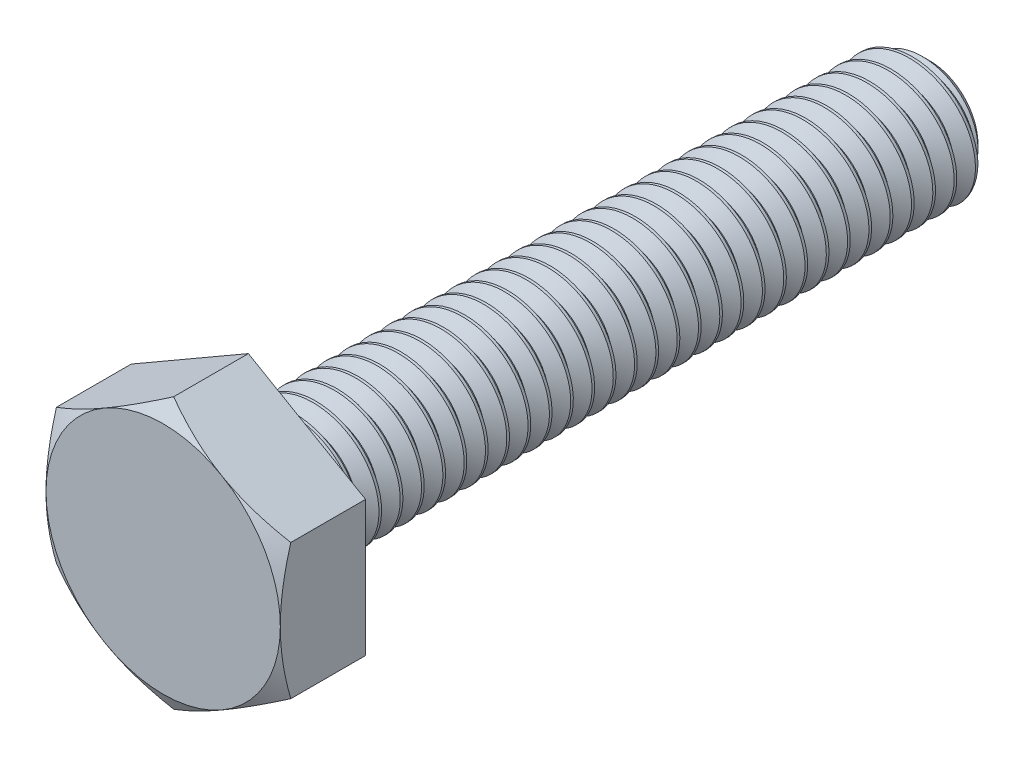
from build123d import *

# Parameters (mm, degrees)
BOSS_EXTRUDE1_DEPTH = 2
SKETCH4_OUTSIDE_W   = 78.966
SKETCH4_OUTSIDE_H   = 79.816
SKETCH4_OUTSIDE_R   = 2.75
CUT_EXTRUDE1_DEPTH  = 19.483663959
CUT_EXTRUDE1_DRAFT  = -60
CUT_SWEEP1_PITCH    = 0.5
CUT_SWEEP1_TO       = 16


with BuildPart() as part:
    # Sketch2 → Revolve1 (revolve)
    with BuildSketch(Plane(origin=(0, 0, 0), x_dir=(0, 0, -1), z_dir=(1, 0, 0)), mode=Mode.PRIVATE) as revolve1_sk:
        Polygon((-9, 2.75), (-9, 0), (9, 0), (9, 1.125), (8.625, 1.5), (-7, 1.5), (-7, 2.75), align=None)
    revolve(revolve1_sk.sketch.rotate(Axis((0, 0, 9), (0, 0, -1)), 90), axis=Axis((0, 0, 9), (0, 0, -1)))

    # Sketch3 → Boss-Extrude1 (add)
    with BuildSketch(Plane.XY.offset(9)):
        Polygon((0, 3.175426481), (-2.75, 1.58771324), (-2.75, -1.58771324), (0, -3.175426481), (2.75, -1.58771324), (2.75, 1.58771324), align=None)
    extrude(amount=-BOSS_EXTRUDE1_DEPTH)


with BuildPart() as cut_extrude1_tool:
    # Sketch4 outside → Cut-Extrude1 (with draft: the straight prism first)
    with BuildSketch(Plane.XY.offset(9)):
        Rectangle(SKETCH4_OUTSIDE_W, SKETCH4_OUTSIDE_H)
        Circle(SKETCH4_OUTSIDE_R, mode=Mode.SUBTRACT)
    extrude(amount=-CUT_EXTRUDE1_DEPTH)
    # Cut-Extrude1: the draft: its side faces are tilted about the plane it starts from
    cut_extrude1_sides = [cut_extrude1_tool.faces().sort_by_distance(p)[0] for p in [
        (0, -39.908, -0.741831979),
        (39.483, 0, -0.741831979),
        (0, 39.908, -0.741831979),
        (-39.483, 0, -0.741831979),
        (-2.75, 0, -0.741831979),
    ]]
    draft(cut_extrude1_sides, Plane.XY.offset(9), CUT_EXTRUDE1_DRAFT)


with BuildPart() as part_1:
    add(part.part)

    # Cut-Extrude1: cut by cut_extrude1_tool
    add(cut_extrude1_tool.part, mode=Mode.SUBTRACT)


with BuildPart() as body_2:
    # Split1: read off the stored shape, not the designer's step
    # Split1: the piece on the far side of the plane
    add(part_1.part)
    split(bisect_by=Plane.XY.offset(7), keep=Keep.BOTTOM)

    # Cut-Sweep1: arcs per turn and ends read off the stored shape
    # Cut-Sweep1: the profile of Sketch7 screwed along a right-hand helix through 33 turns, 6 arcs to a turn; built about Z, then put on its axis
    cut_sweep1_z = Axis((0, 0, 0), (0, 0, 1))
    cut_sweep1_corners = [(1.527063294, 0, 0.015625), (1.175240474, 0, -0.1875), (1.175240474, 0, -0.25), (1.527063294, 0, -0.453125)]
    with BuildLine(mode=Mode.PRIVATE) as cut_sweep1_profile:
        Line(cut_sweep1_corners[0], cut_sweep1_corners[1])
        Line(cut_sweep1_corners[1], cut_sweep1_corners[2])
        Line(cut_sweep1_corners[2], cut_sweep1_corners[3])
        Line(cut_sweep1_corners[3], cut_sweep1_corners[0])
    cut_sweep1_cap = Face(cut_sweep1_profile.wire())
    cut_sweep1_turn_angles = [0, 30, 60, 90, 120, 150, 180, 210, 240, 270, 300, 330, 360]
    cut_sweep1_turn_weights = [1, 0.8660254037844387, 1, 0.8660254037844387, 1, 0.8660254037844387, 1, 0.8660254037844387, 1, 0.8660254037844387, 1, 0.8660254037844387, 1]
    cut_sweep1_turn_rails = [Edge.make_bspline([Vector(p[0], p[1], 0).rotate(cut_sweep1_z, cut_sweep1_turn_angles[k]) / cut_sweep1_turn_weights[k] + Vector(0, 0, p[2] + CUT_SWEEP1_PITCH * cut_sweep1_turn_angles[k] / 360) for k in range(13)], [0, 0, 0, 1, 1, 2, 2, 3, 3, 4, 4, 5, 5, 6, 6, 6], 2, cut_sweep1_turn_weights) for p in cut_sweep1_corners]
    cut_sweep1_turn_sides = [Face.make_surface_from_curves(cut_sweep1_turn_rails[p[0]], cut_sweep1_turn_rails[p[1]]) for p in [(0, 1), (1, 2), (2, 3), (3, 0)]]
    cut_sweep1 = Plane(origin=(0, 0, -9), x_dir=(0, 1, 0), z_dir=(0, 0, 1)) * split(Solid(Shell([*[p.moved(Location((0, 0, CUT_SWEEP1_PITCH * i))) for i in range(33) for p in cut_sweep1_turn_sides], cut_sweep1_cap, cut_sweep1_cap.rotate(cut_sweep1_z, 11880).moved(Location((0, 0, CUT_SWEEP1_PITCH * 11880 / 360)))])), bisect_by=Plane.XY.offset(CUT_SWEEP1_TO), keep=Keep.BOTTOM, mode=Mode.PRIVATE)
    add(cut_sweep1, mode=Mode.SUBTRACT)


with BuildPart() as part_2:
    add(part_1.part)

    # Split1
    split(bisect_by=Plane.XY.offset(7), keep=Keep.TOP)

    add(body_2.part)  # Boss-Extrude2 merges body 2
    # Boss-Extrude2: read off the stored shape, not the designer's step
    # Boss-Extrude2 outline → Boss-Extrude2 (revolve)
    with BuildSketch(Plane.XZ):
        Polygon((1.175239357, 7), (1.175239357, 6.107727466), (1.5, 7), align=None)
    revolve(axis=Axis((0, 0, 0), (0, 0, 1)))


solid = part_2.part
